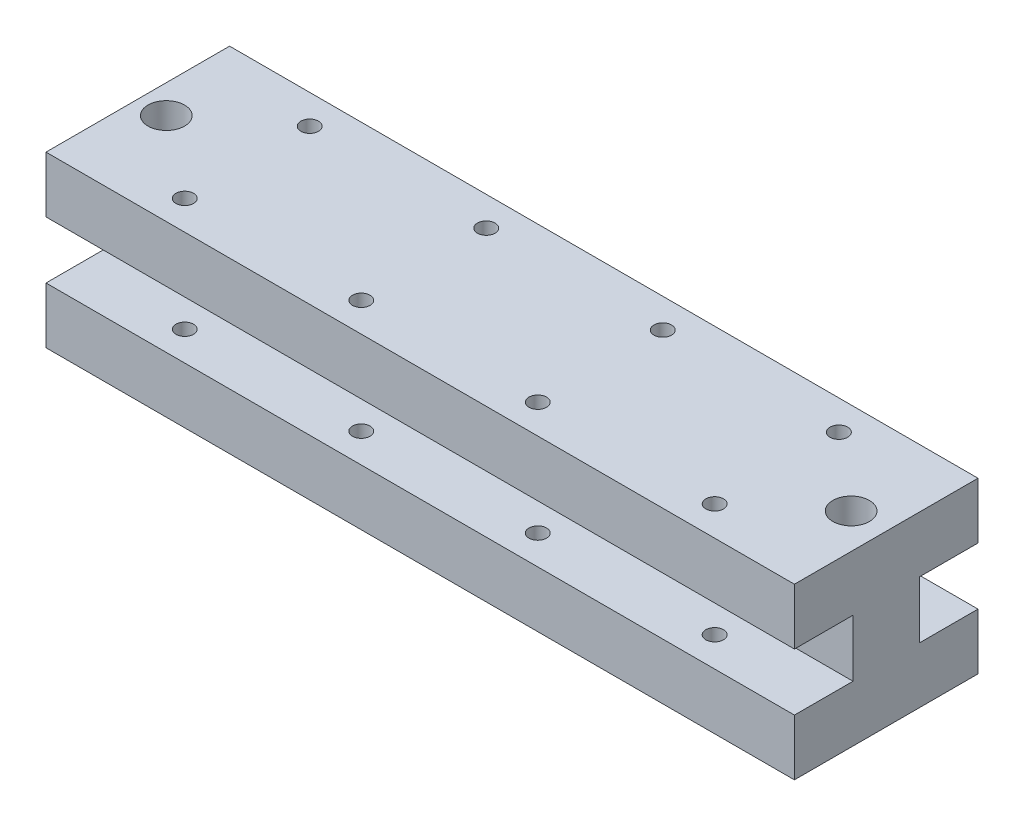
from build123d import *

# Parameters (mm, degrees)
SKETCH4_W                  = 106
SKETCH4_H                  = 24
BOSS_EXTRUDE2_DEPTH        = 13
CUT_EXTRUDE3_START         = -8.3
SKETCH25_W                 = 106
SKETCH25_H                 = 8.1
CUT_EXTRUDE3_DEPTH         = 108.807903902
M3X0_5_TAPPED_HOLE1_D      = 2.5
MIRROR3_START              = -40.65
MIRROR3_OUTLINE_W          = 106
MIRROR3_OUTLINE_H          = 4.7
MIRROR3_DEPTH              = 24
MIRROR3_START_2            = -24.601316976
MIRROR3_2_OUTLINE_W        = 106
MIRROR3_2_OUTLINE_H        = 8.3
MIRROR3_2_OUTLINE_R        = 1.25
MIRROR3_2_DEPTH            = 7.951316976
MIRROR3_3_OUTLINE_W        = 106
MIRROR3_3_OUTLINE_H        = 8.3
MIRROR3_3_OUTLINE_R        = 1.25
MIRROR3_3_DEPTH            = 7.948683024
F_6_0_204_DIAMETER_HOLE1_D = 5.1816


# Read off the part's stored shape, not the designer's step: Mirror3
with BuildPart() as part:
    # Sketch4 → Boss-Extrude2 (new body)
    with BuildSketch(Plane.XY):
        with Locations((-36.891047602, -28.65)):
            Rectangle(SKETCH4_W, SKETCH4_H)
    extrude(amount=-BOSS_EXTRUDE2_DEPTH)

    # Sketch25 → Cut-Extrude3 (cut)
    with BuildSketch(Plane.XY.offset(CUT_EXTRUDE3_START)):
        with Locations((-36.891047602, -28.651316976)):
            Rectangle(SKETCH25_W, SKETCH25_H)
    extrude(amount=CUT_EXTRUDE3_DEPTH, mode=Mode.SUBTRACT)

    # M3x0.5 Tapped Hole1 (through all)
    with Locations(Plane(origin=(-74.390985602, -16.65, -4.15), x_dir=(0, 0, 1), z_dir=(0, 1, 0))):
        with Locations((0, 0), (0, 25), (-0.055677319, 74.999938), (0, 50)):
            Hole(M3X0_5_TAPPED_HOLE1_D / 2)

    # Mirror3 outline → Mirror3 (add)
    with BuildSketch(Plane(origin=(0, 0, 0), x_dir=(1, 0, 0), z_dir=(0, 1, 0)).offset(MIRROR3_START)):
        with Locations((-36.891047602, 15.35)):
            Rectangle(MIRROR3_OUTLINE_W, MIRROR3_OUTLINE_H)
    extrude(amount=MIRROR3_DEPTH)

    # Mirror3 2 outline → Mirror3 2 (add)
    with BuildSketch(Plane(origin=(0, 0, 0), x_dir=(1, 0, 0), z_dir=(0, 1, 0)).offset(MIRROR3_START_2)):
        with Locations((-36.891047602, 21.85)):
            Rectangle(MIRROR3_2_OUTLINE_W, MIRROR3_2_OUTLINE_H)
        with Locations((-74.390985602, 21.85)):
            Circle(MIRROR3_2_OUTLINE_R, mode=Mode.SUBTRACT)
        with Locations((-49.390985602, 21.85)):
            Circle(MIRROR3_2_OUTLINE_R, mode=Mode.SUBTRACT)
        with Locations((-24.390985602, 21.85)):
            Circle(MIRROR3_2_OUTLINE_R, mode=Mode.SUBTRACT)
        with Locations((0.608952398, 21.794322681)):
            Circle(MIRROR3_2_OUTLINE_R, mode=Mode.SUBTRACT)
    extrude(amount=MIRROR3_2_DEPTH)

    # Mirror3 3 outline → Mirror3 3 (add)
    with BuildSketch(Plane(origin=(0, 0, 0), x_dir=(1, 0, 0), z_dir=(0, 1, 0)).offset(MIRROR3_START)):
        with Locations((-36.891047602, 21.85)):
            Rectangle(MIRROR3_3_OUTLINE_W, MIRROR3_3_OUTLINE_H)
        with Locations((-74.390985602, 21.85)):
            Circle(MIRROR3_3_OUTLINE_R, mode=Mode.SUBTRACT)
        with Locations((-49.390985602, 21.85)):
            Circle(MIRROR3_3_OUTLINE_R, mode=Mode.SUBTRACT)
        with Locations((-24.390985602, 21.85)):
            Circle(MIRROR3_3_OUTLINE_R, mode=Mode.SUBTRACT)
        with Locations((0.608952398, 21.794322681)):
            Circle(MIRROR3_3_OUTLINE_R, mode=Mode.SUBTRACT)
    extrude(amount=MIRROR3_3_DEPTH)

    # #6 (0.204) Diameter Hole1 (through all)
    with Locations(Plane(origin=(11.140604923, -40.65, -13), x_dir=(0, 0, -1), z_dir=(0, -1, 0))):
        with Locations((0, 0), (0, -96.994839557)):
            Hole(F_6_0_204_DIAMETER_HOLE1_D / 2)


solid = part.part
